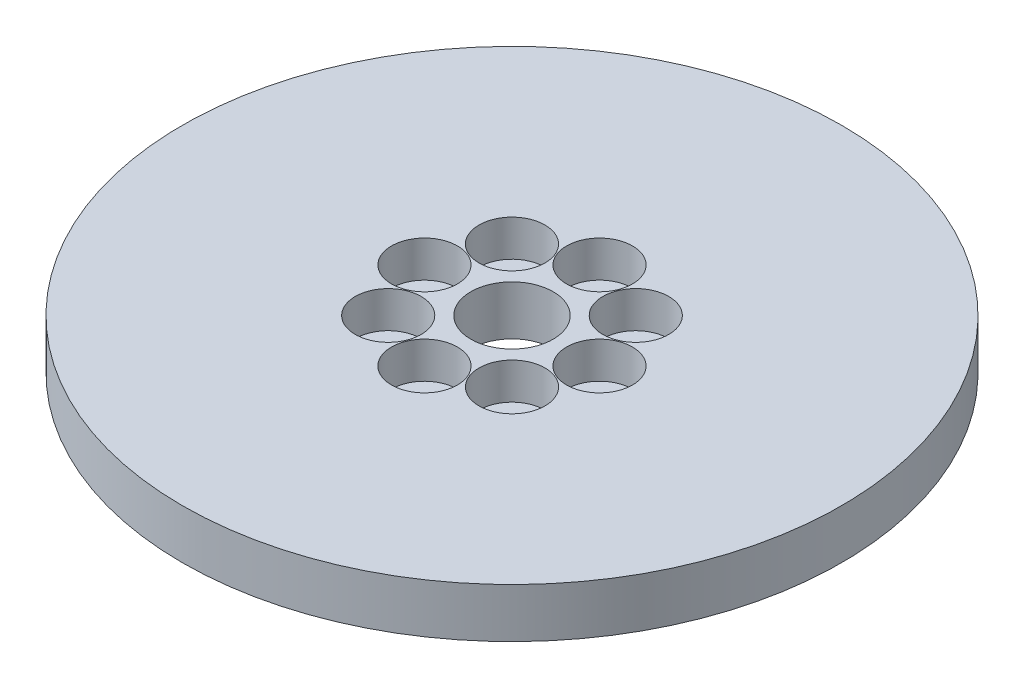
from build123d import *

# Parameters (mm, degrees)
SKETCH1_R           = 100
BOSS_EXTRUDE1_DEPTH = 15
SKETCH2_R           = 12.5
CUT_EXTRUDE1_DEPTH  = 143.214626533
SKETCH3_R           = 10
CUT_EXTRUDE2_DEPTH  = 11.07267209
CIRPATTERN1_COUNT   = 8


with BuildPart() as part:
    # Sketch1 → Boss-Extrude1 (new body)
    with BuildSketch(Plane(origin=(0, 0, 0), x_dir=(1, 0, 0), z_dir=(0, 1, 0))):
        Circle(SKETCH1_R)
    extrude(amount=BOSS_EXTRUDE1_DEPTH)

    # Sketch2 → Cut-Extrude1 (cut, through all)
    with BuildSketch(Plane(origin=(0, 0, 0), x_dir=(1, 0, 0), z_dir=(0, 1, 0))):
        Circle(SKETCH2_R)
    extrude(amount=CUT_EXTRUDE1_DEPTH, mode=Mode.SUBTRACT)

    # Sketch3 → Cut-Extrude2 (cut)
    with BuildSketch(Plane(origin=(0, 15, 0), x_dir=(1, 0, 0), z_dir=(0, 1, 0))):
        with Locations((-26.560467398, 0)):
            Circle(SKETCH3_R)
    cut_extrude2 = extrude(amount=-CUT_EXTRUDE2_DEPTH, mode=Mode.SUBTRACT)

    # CirPattern1: Cut-Extrude2 ×8 about axis
    cirpattern1_axis = Axis((0, 0, 0), (0, 1, 0))
    for i in range(1, CIRPATTERN1_COUNT):
        add(cut_extrude2.rotate(cirpattern1_axis, i * 360 / CIRPATTERN1_COUNT), mode=Mode.SUBTRACT)


solid = part.part
